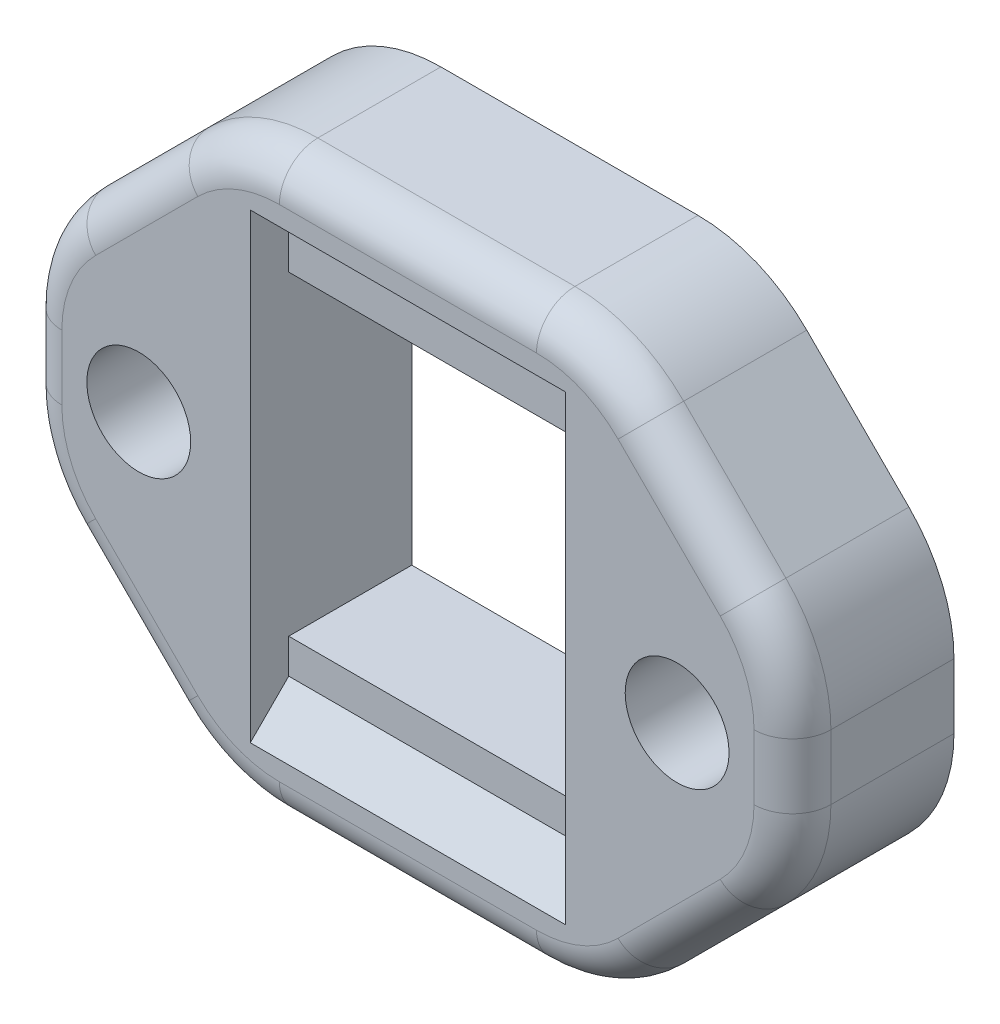
from build123d import *

# Parameters (mm, degrees)
SKETCH1_W           = 20
SKETCH1_H           = 15
BOSS_EXTRUDE1_DEPTH = 4.2
SKETCH2_W           = 8.2
SKETCH2_H           = 10
CUT_EXTRUDE1_DEPTH  = 1
SKETCH3_W           = 8.2
SKETCH3_H           = 8.2
CUT_EXTRUDE2_DEPTH  = 29.564762277
CHAMFER1_SIZE       = 1
SKETCH4_R           = 1.35
CUT_EXTRUDE3_DEPTH  = 29.694000139
CHAMFER2_SIZE       = 5
FILLET1_R           = 4
FILLET2_R           = 1


with BuildPart() as part:
    # Sketch1 → Boss-Extrude1 (new body)
    with BuildSketch(Plane.XY):
        with Locations((10, 12.642136033)):
            Rectangle(SKETCH1_W, SKETCH1_H)
    extrude(amount=BOSS_EXTRUDE1_DEPTH)

    # Sketch2 → Cut-Extrude1 (cut)
    with BuildSketch(Plane.XY.offset(4.2)):
        with Locations((10, 12.642136033)):
            Rectangle(SKETCH2_W, SKETCH2_H)
    extrude(amount=-CUT_EXTRUDE1_DEPTH, mode=Mode.SUBTRACT)

    # Sketch3 → Cut-Extrude2 (cut, through all)
    with BuildSketch(Plane.XY.offset(3.2)):
        with Locations((10, 12.642136033)):
            Rectangle(SKETCH3_W, SKETCH3_H)
    extrude(amount=-CUT_EXTRUDE2_DEPTH, mode=Mode.SUBTRACT)

    # Chamfer1
    chamfer1_edges = [part.edges().sort_by_distance(p)[0] for p in [
        (10, 7.642136033, 4.2),
        (10, 17.642136033, 4.2),
    ]]
    chamfer(chamfer1_edges, length=CHAMFER1_SIZE - 0.0001)  # a hair under: the kernel refuses the full size

    # Sketch4 → Cut-Extrude3 (cut, through all)
    with BuildSketch(Plane.XY.offset(4.2)):
        with Locations((3, 12.642136033)):
            Circle(SKETCH4_R)
        with Locations(Location((17, 12.642136033, 0), (0, 0, 180))):
            Circle(SKETCH4_R)
    extrude(amount=-CUT_EXTRUDE3_DEPTH, mode=Mode.SUBTRACT)

    # Chamfer2
    chamfer2_edges = [part.edges().sort_by_distance(p)[0] for p in [
        (0, 20.142136033, 2.1),
        (20, 20.142136033, 2.1),
        (20, 5.142136033, 2.1),
        (0, 5.142136033, 2.1),
    ]]
    chamfer(chamfer2_edges, length=CHAMFER2_SIZE)

    # Fillet1
    fillet1_edges = [part.edges().sort_by_distance(p)[0] for p in [
        (0, 10.142136033, 2.1),
        (0, 15.142136033, 2.1),
        (15, 20.142136033, 2.1),
        (5, 20.142136033, 2.1),
        (15, 5.142136033, 2.1),
        (5, 5.142136033, 2.1),
        (20, 15.142136033, 2.1),
        (20, 10.142136033, 2.1),
    ]]
    fillet(fillet1_edges, radius=FILLET1_R)

    # Fillet2
    fillet2_edges = [part.edges().sort_by_distance(p)[0] for p in [
        (2.5, 17.642136033, 4.2),
        (10, 20.142136033, 4.2),
        (2.5, 7.642136033, 4.2),
        (10, 5.142136033, 4.2),
        (17.5, 7.642136033, 4.2),
        (20, 12.642136033, 4.2),
        (17.5, 17.642136033, 4.2),
        (0.30448187, 10.268256553, 4.2),
        (5.12612052, 5.446617903, 4.2),
        (14.87387948, 5.446617903, 4.2),
        (19.69551813, 10.268256553, 4.2),
        (19.69551813, 15.016015513, 4.2),
        (14.87387948, 19.837654163, 4.2),
        (5.12612052, 19.837654163, 4.2),
        (0.30448187, 15.016015513, 4.2),
        (0, 12.642136033, 4.2),
    ]]
    fillet(fillet2_edges, radius=FILLET2_R)


solid = part.part
